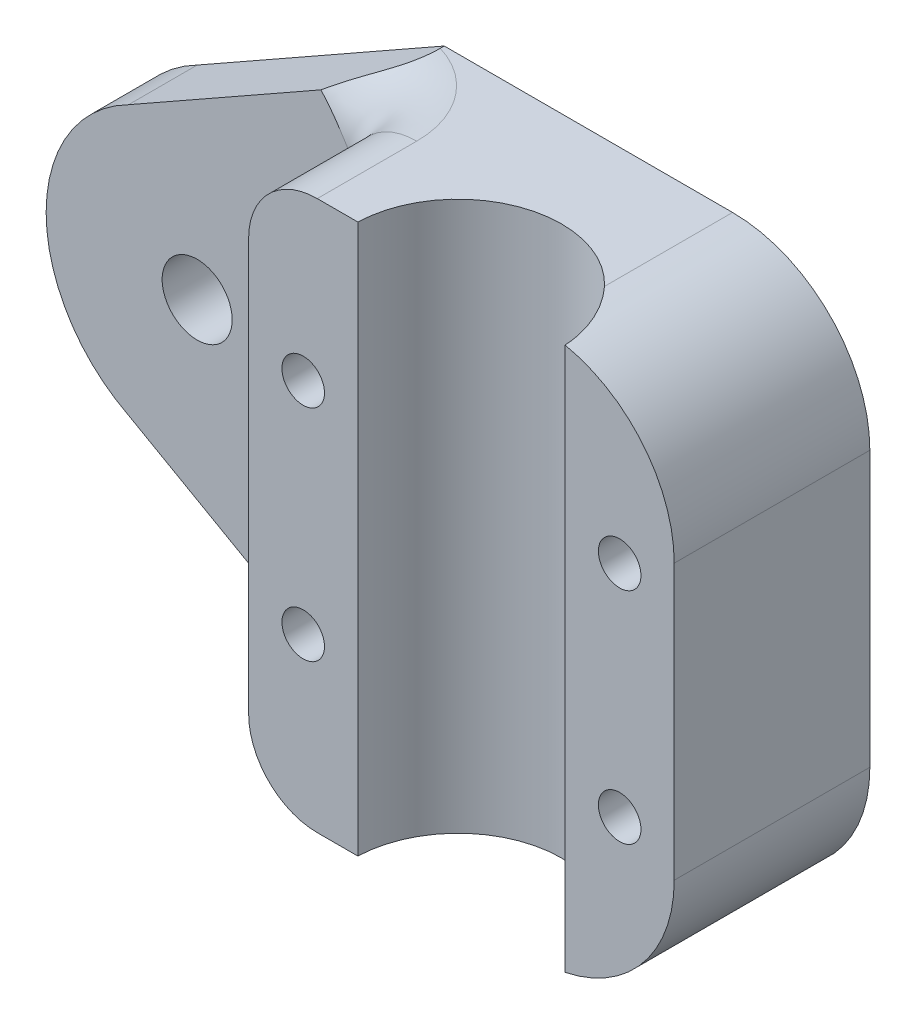
from build123d import *

# Parameters (mm, degrees)
SKETCH_3_R          = 2.55
SKETCH_3_R_2        = 1.55
EXTRUDE_1_DEPTH     = 5
SKETCH_4_R          = 1.55
EXTRUDE_2_DEPTH     = 9.25
FILLET_1_R          = 2
FILLET_START        = 6.9999999
FILLET_2_2_DEPTH    = 8.0000001
SKETCH_5_R          = 3
CUT_EXTRUDE_1_DEPTH = 2.5
SKETCH_6_R          = 7.55
CUT_EXTRUDE_2_DEPTH = 62.147874109


with BuildPart() as part:
    # 草图3 → 凸台-拉伸1 (new body)
    with BuildSketch(Plane.XY):
        with BuildLine():
            Line((13, 20), (34, 20))
            ThreePointArc((34, 20), (41.071067812, 17.071067812), (44, 10))
            Line((44, 10), (44, -10))
            ThreePointArc((44, -10), (41.071067812, -17.071067812), (34, -20))
            Line((34, -20), (13, -20))
            Line((13, -20), (-5, -9.797958971))
            ThreePointArc((-5, -9.797958971), (-11, 0), (-5, 9.797958971))
            Line((-5, 9.797958971), (13, 20))
        make_face()
        Circle(SKETCH_3_R, mode=Mode.SUBTRACT)
        with Locations((40.025, 8)):
            Circle(SKETCH_3_R_2, mode=Mode.SUBTRACT)
        with Locations((40.025, -8)):
            Circle(SKETCH_3_R_2, mode=Mode.SUBTRACT)
        with Locations((16.975, -8)):
            Circle(SKETCH_3_R_2, mode=Mode.SUBTRACT)
        with Locations((16.975, 8)):
            Circle(SKETCH_3_R_2, mode=Mode.SUBTRACT)
    extrude(amount=EXTRUDE_1_DEPTH)

    # 草图4 → 凸台-拉伸2 (add)
    with BuildSketch(Plane.XY.offset(5)):
        with BuildLine():
            Line((13, 20), (34, 20))
            ThreePointArc((34, 20), (41.071067812, 17.071067812), (44, 10))
            Line((44, 10), (44, -10))
            ThreePointArc((44, -10), (41.071067812, -17.071067812), (34, -20))
            Line((34, -20), (13, -20))
            Line((13, -20), (13, 20))
        make_face()
        with Locations((16.975, -8)):
            Circle(SKETCH_4_R, mode=Mode.SUBTRACT)
        with Locations((16.975, 8)):
            Circle(SKETCH_4_R, mode=Mode.SUBTRACT)
        with Locations((40.025, 8)):
            Circle(SKETCH_4_R, mode=Mode.SUBTRACT)
        with Locations((40.025, -8)):
            Circle(SKETCH_4_R, mode=Mode.SUBTRACT)
    extrude(amount=EXTRUDE_2_DEPTH)

    # 圆角1
    fillet_1_edges = [part.edges().sort_by_distance(p)[0] for p in [
        (13, 0, 5),
    ]]
    fillet(fillet_1_edges, radius=FILLET_1_R)

    # 圆角2: read off the stored shape, not the designer's step
    # 圆角2 outline → 圆角2 (revolve, cut)
    with BuildSketch(Plane(origin=(11, 0, 7), x_dir=(1, 0, 0), z_dir=(0, 0, 1))):
        with BuildLine():
            ThreePointArc((7, -20), (3.464466094, -18.535533906), (2, -15))
            Line((2, -15), (2, -20))
            Line((2, -20), (7, -20))
        make_face()
        with BuildLine():
            Line((2, 20), (2, 15))
            ThreePointArc((2, 15), (3.464466094, 18.535533906), (7, 20))
            Line((7, 20), (2, 20))
        make_face()
    revolve(axis=Axis((11, 0, 7), (0, 1, 0)), mode=Mode.SUBTRACT)

    # Fillet 2 2 outline → Fillet 2 2 (cut)
    with BuildSketch(Plane.XY.offset(FILLET_START)):
        with BuildLine():
            Line((13, -20), (18, -20))
            ThreePointArc((18, -20), (14.464466094, -18.535533906), (13, -15))
            Line((13, -15), (13, -20))
        make_face()
        with BuildLine():
            Line((13, 20), (13, 15))
            ThreePointArc((13, 15), (14.464466094, 18.535533906), (18, 20))
            Line((18, 20), (13, 20))
        make_face()
    extrude(amount=FILLET_2_2_DEPTH, mode=Mode.SUBTRACT)

    # 草图5 → 切除-拉伸1 (cut)
    with BuildSketch(Plane(origin=(0, 0, 0), x_dir=(-1, 0, 0), z_dir=(0, 0, -1))):
        with Locations((-40.025, 8)):
            Circle(SKETCH_5_R)
        with Locations((-16.975, 8)):
            Circle(SKETCH_5_R)
        with Locations((-16.975, -8)):
            Circle(SKETCH_5_R)
        with Locations((-40.025, -8)):
            Circle(SKETCH_5_R)
    extrude(amount=-CUT_EXTRUDE_1_DEPTH, mode=Mode.SUBTRACT)

    # 草图6 → 切除-拉伸2 (cut, through all)
    with BuildSketch(Plane.XZ.offset(20)):
        with Locations((28.5, 14.5)):
            Circle(SKETCH_6_R)
    extrude(amount=-CUT_EXTRUDE_2_DEPTH, mode=Mode.SUBTRACT)


solid = part.part
